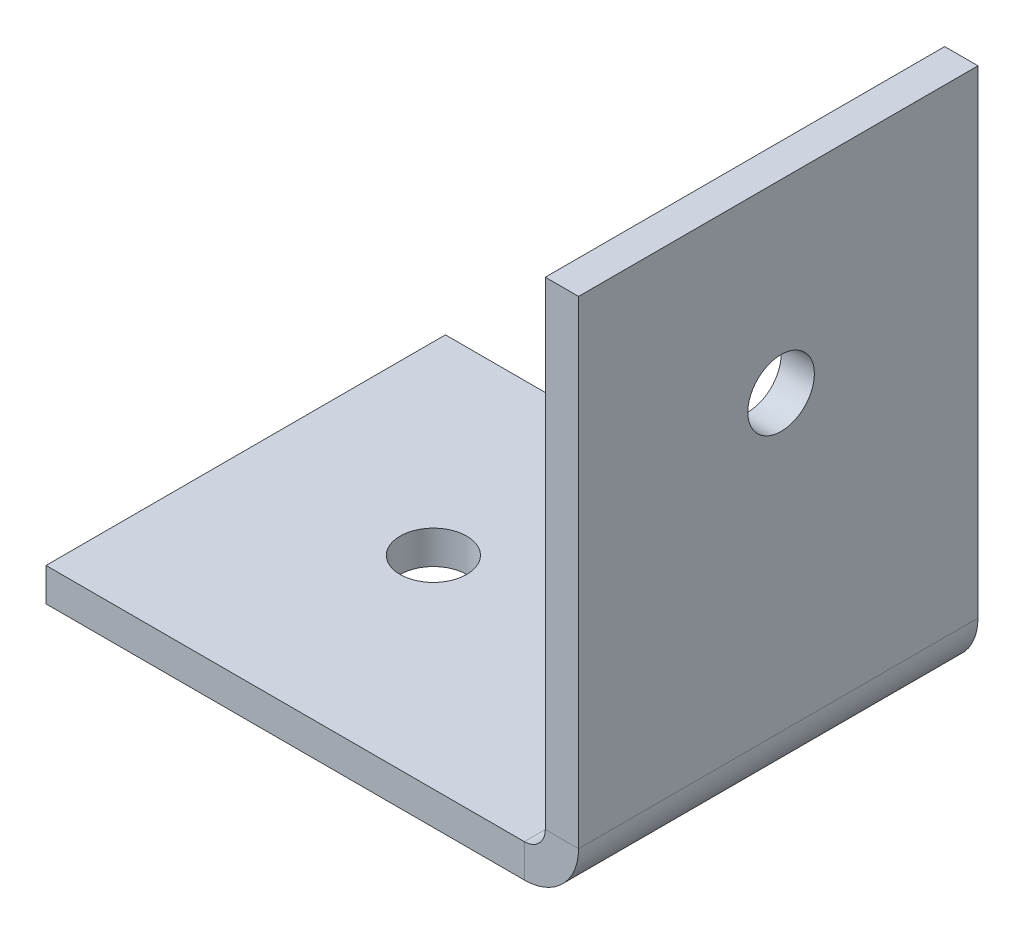
from build123d import *

# Parameters (mm, degrees)
SKETCH1_W                    = 25.4
SKETCH1_H                    = 19.05
BASE_FLANGE1_DEPTH           = 1.5875
EDGE_FLANGE1_STRIP_W         = 8.35
EDGE_FLANGE1_STRIP_H         = 1.5875
EDGE_FLANGE1_STRIP_CUT_DEPTH = 19.05
EDGE_FLANGE1_DEPTH           = 19.05
F_1_8_0_125_DIAMETER_HOLE1_D = 3.175
F_1_8_0_125_DIAMETER_HOLE2_D = 3.175


# Sheet-metal steps are written as plain solids
with BuildPart() as part:
    # Sketch1 → Base-Flange1 (new body)
    with BuildSketch(Plane(origin=(0, 0, 0), x_dir=(1, 0, 0), z_dir=(0, 1, 0))):
        with Locations((12.7, 9.525)):
            Rectangle(SKETCH1_W, SKETCH1_H)
    extrude(amount=-BASE_FLANGE1_DEPTH)

    # Edge-Flange1 strip (across the edge) → Edge-Flange1 strip cut (cut)
    with BuildSketch(Plane(origin=(25.4, 0, 0), x_dir=(-1, 0, 0), z_dir=(0, 0, -1))):
        with Locations((-1.5875, -0.79375)):
            Rectangle(EDGE_FLANGE1_STRIP_W, EDGE_FLANGE1_STRIP_H)
    extrude(amount=EDGE_FLANGE1_STRIP_CUT_DEPTH, mode=Mode.SUBTRACT)

    # Edge-Flange1 section (across the edge) → Edge-Flange1 (add)
    with BuildSketch(Plane(origin=(25.4, 0, 0), x_dir=(-1, 0, 0), z_dir=(0, 0, -1))):
        with BuildLine():
            Line((0, 1), (0, 23.8125))
            Line((0, 23.8125), (1.5875, 23.8125))
            Line((1.5875, 23.8125), (1.5875, 1))
            ThreePointArc((1.5875, 1), (1.880393219, 0.292893219), (2.5875, 0))
            Line((2.5875, 0), (2.5875, -1.5875))
            ThreePointArc((2.5875, -1.5875), (0.757861204, -0.829638796), (0, 1))
        make_face()
    extrude(amount=EDGE_FLANGE1_DEPTH)

    # 1/8 (0.125) Diameter Hole1 (through all)
    with Locations(Plane(origin=(25.4, 0, 0), x_dir=(0, 0, -1), z_dir=(1, 0, 0))):
        with Locations((9.658223344, 14.994606781)):
            Hole(F_1_8_0_125_DIAMETER_HOLE1_D / 2)

    # 1/8 (0.125) Diameter Hole2 (through all)
    with Locations(Plane(origin=(0, -1.5875, 0), x_dir=(-1, 0, 0), z_dir=(0, -1, 0))):
        with Locations((-8.817893219, 9.658223344)):
            Hole(F_1_8_0_125_DIAMETER_HOLE2_D / 2)


solid = part.part
